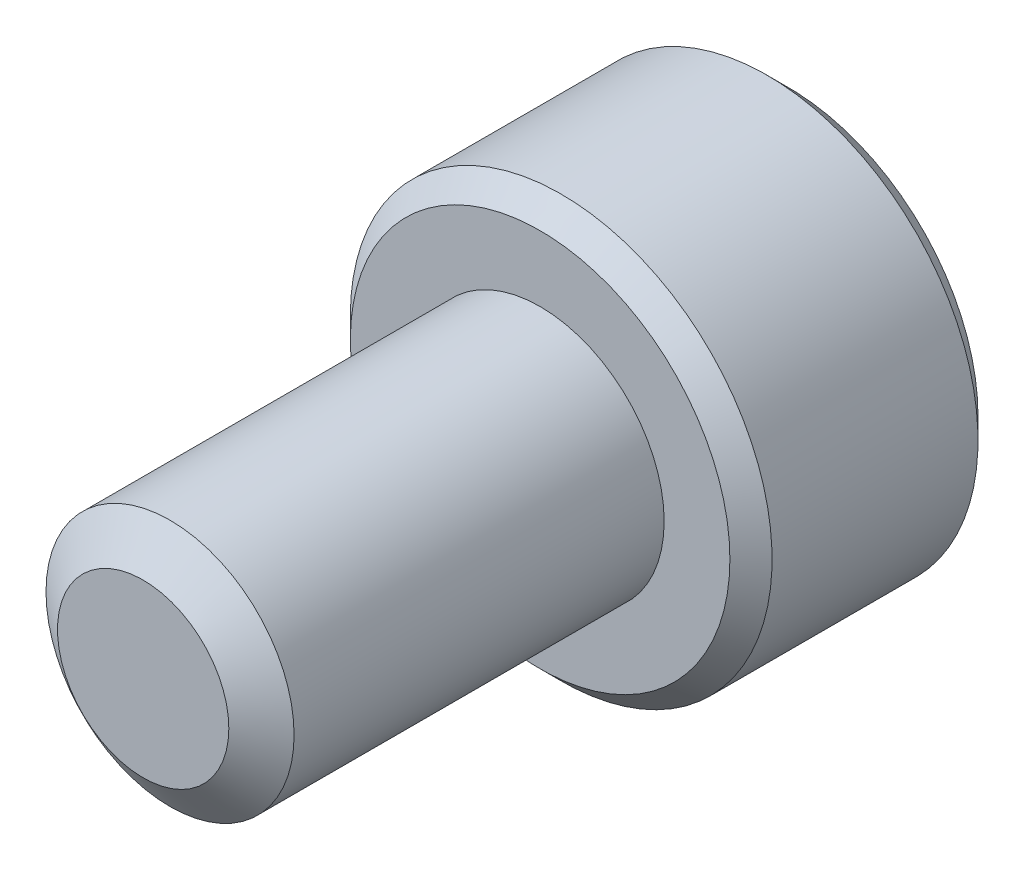
from build123d import *

# Parameters (mm, degrees)
SKETCH1_R          = 2.5
EXTRUDE1_DEPTH     = 8
SKETCH6_R          = 4.25
EXTRUDE2_DEPTH     = 5
CUT_EXTRUDE1_DEPTH = 3
CHAMFER1_SIZE      = 0.425


with BuildPart() as part:
    # Sketch1 → Extrude1 (new body)
    with BuildSketch(Plane.XY):
        Circle(SKETCH1_R)
    extrude(amount=-EXTRUDE1_DEPTH)

    # Sketch4 → Cut-Revolve1 (revolve, cut)
    with BuildSketch(Plane(origin=(0, 0, 0), x_dir=(0, 0, -1), z_dir=(1, 0, 0))):
        Polygon((0.541691224, 2.5), (0, 1.726384758), (0, 2.5), align=None)
    revolve(axis=Axis((0, 0, 0), (0, 0, -1)), mode=Mode.SUBTRACT)

    # Sketch6 → Extrude2 (add)
    with BuildSketch(Plane(origin=(0, 0, -8), x_dir=(-1, 0, 0), z_dir=(0, 0, -1))):
        Circle(SKETCH6_R)
    extrude(amount=EXTRUDE2_DEPTH)

    # Sketch7 → Cut-Extrude1 (cut)
    with BuildSketch(Plane(origin=(0, 0, -13), x_dir=(-1, 0, 0), z_dir=(0, 0, -1))):
        Polygon((0, 2.309401077), (-2, 1.154700538), (-2, -1.154700538), (0, -2.309401077), (2, -1.154700538), (2, 1.154700538), align=None)
    extrude(amount=-CUT_EXTRUDE1_DEPTH, mode=Mode.SUBTRACT)

    # Cut-Extrude2 cone 1 section (through the dimple's axis) → Cut-Extrude2 (revolve, cut)
    with BuildSketch(Plane(origin=(0, 0, -13), x_dir=(0, 1, 0), z_dir=(1, 0, 0))):
        Polygon((0, 0), (2.309401077, 0), (0, 2.309401077), align=None)
    revolve(axis=Axis((0, 0, -13), (0, 0, 1)), mode=Mode.SUBTRACT)

    # Chamfer1
    chamfer1_edges = [part.edges().sort_by_distance(p)[0] for p in [
        (4.25, 0, -13),
        (4.25, 0, -8),
    ]]
    chamfer(chamfer1_edges, length=CHAMFER1_SIZE)


solid = part.part
